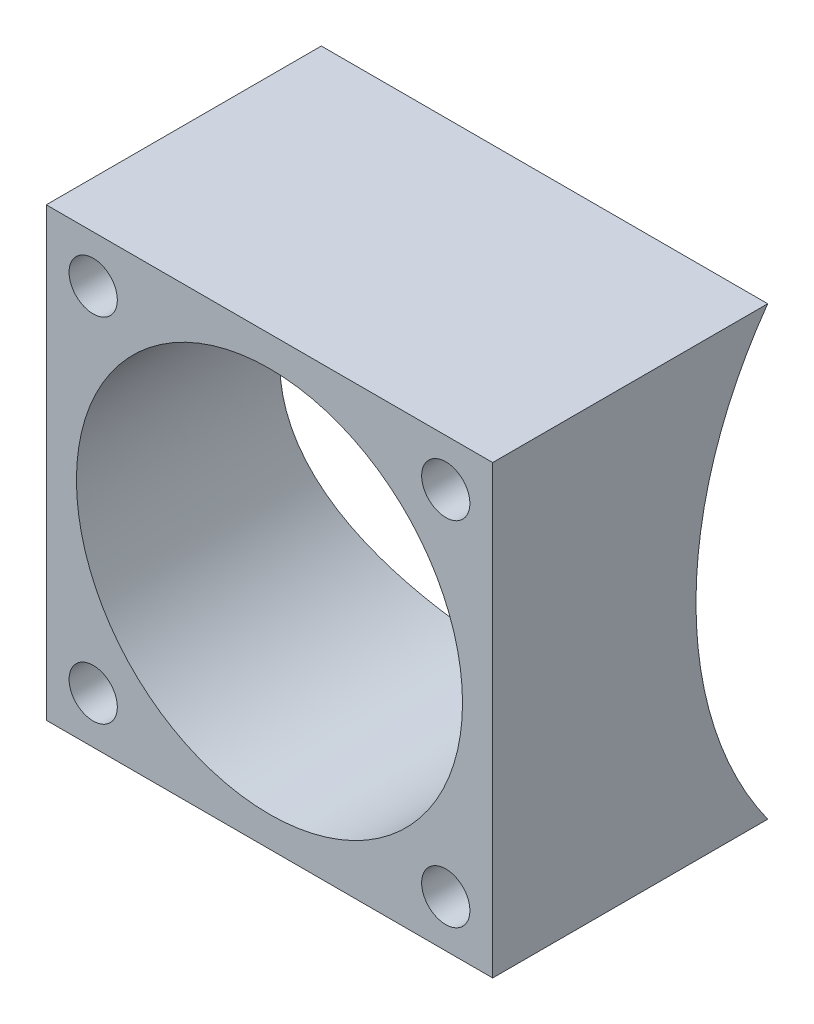
from build123d import *

# Parameters (mm, degrees)
SKETCH1_W               = 37
SKETCH1_H               = 37
BOSS_EXTRUDE1_DEPTH     = 48.6
CUT_EXTRUDE1_DEPTH      = 20
CUT_EXTRUDE1_DEPTH_BACK = 20
SKETCH2_R               = 31.75
SKETCH5_R               = 16
CUT_EXTRUDE2_DEPTH      = 56.194746127
SKETCH6_R               = 2
CUT_EXTRUDE3_DEPTH      = 35.701406184


with BuildPart() as part:
    # Sketch1 → Boss-Extrude1 (new body)
    with BuildSketch(Plane.XY):
        Rectangle(SKETCH1_W, SKETCH1_H)
    extrude(amount=BOSS_EXTRUDE1_DEPTH)

    # Sketch2 → Cut-Extrude1 (cut, two sides: drawn at the far end of the back side and taken through both)
    with BuildSketch(Plane(origin=(0, 0, 0), x_dir=(0, 0, -1), z_dir=(1, 0, 0)).offset(-CUT_EXTRUDE1_DEPTH_BACK)):
        Circle(SKETCH2_R)
    extrude(amount=CUT_EXTRUDE1_DEPTH + CUT_EXTRUDE1_DEPTH_BACK, mode=Mode.SUBTRACT)

    # Sketch5 → Cut-Extrude2 (cut, through all)
    with BuildSketch(Plane.XY):
        Circle(SKETCH5_R)
    extrude(amount=CUT_EXTRUDE2_DEPTH, mode=Mode.SUBTRACT)

    # Sketch6 → Cut-Extrude3 (cut, through all)
    with BuildSketch(Plane.XY.offset(48.6)):
        with Locations((-14.610912703, -14.610912703)):
            Circle(SKETCH6_R)
        with Locations((14.610912703, -14.610912703)):
            Circle(SKETCH6_R)
        with Locations((14.610912703, 14.610912703)):
            Circle(SKETCH6_R)
        with Locations((-14.610912703, 14.610912703)):
            Circle(SKETCH6_R)
    extrude(amount=-CUT_EXTRUDE3_DEPTH, mode=Mode.SUBTRACT)


solid = part.part
